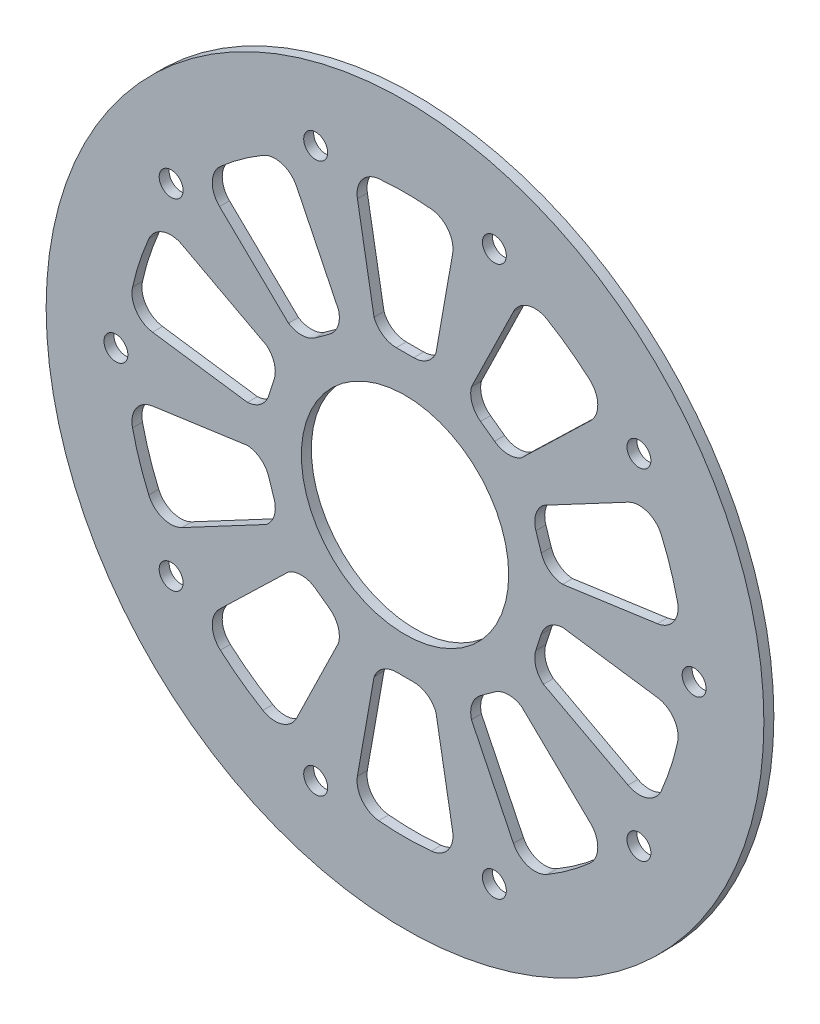
from build123d import *

# Parameters (mm, degrees)
MODEL_R                     = 90
MODEL_R_2                   = 3
MODEL_R_3                   = 26
Y_KSEKLIK_EKSTR_ZYON7_DEPTH = 2.5


with BuildPart() as part:
    # Model → Yükseklik-Ekstrüzyon7 (new body)
    with BuildSketch(Plane.XY):
        Circle(MODEL_R)
        with Locations((-58.653732092, -42.614430791)):
            Circle(MODEL_R_2, mode=Mode.SUBTRACT)
        with Locations((-22.403732092, -68.951597431)):
            Circle(MODEL_R_2, mode=Mode.SUBTRACT)
        with BuildLine():
            ThreePointArc((-18.940576577, -29.779008555), (-16.820231104, -32.605612708), (-16.658403576, -36.135395679))
            Line((-16.658403576, -36.135395679), (-27.194108178, -57.736791298))
            ThreePointArc((-27.194108178, -57.736791298), (-30.862591163, -60.853463931), (-35.640908554, -60.271142184))
            ThreePointArc((-35.640908554, -60.271142184), (-41.157078213, -56.647858351), (-46.307616081, -52.521325533))
            ThreePointArc((-46.307616081, -52.521325533), (-48.338018251, -48.156822957), (-46.50751002, -43.7047835))
            Line((-46.50751002, -43.7047835), (-29.219073725, -27.009534635))
            ThreePointArc((-29.219073725, -27.009534635), (-25.812043174, -26.072678835), (-22.46856009, -27.215778495))
            Line((-22.46856009, -27.215778495), (-18.940576577, -29.779008555))
        make_face(mode=Mode.SUBTRACT)
        with BuildLine():
            ThreePointArc((2.180413722, -35.224715579), (5.55724548, -36.265178576), (7.762921073, -39.025713151))
            Line((7.762921073, -39.025713151), (11.936338777, -62.694341097))
            ThreePointArc((11.936338777, -62.694341097), (10.800407909, -67.37206242), (6.592387799, -69.709578724))
            ThreePointArc((6.592387799, -69.709578724), (0, -70.020603702), (-6.592387799, -69.709578724))
            ThreePointArc((-6.592387799, -69.709578724), (-10.800407909, -67.37206242), (-11.936338777, -62.694341097))
            Line((-11.936338777, -62.694341097), (-7.762921073, -39.025713151))
            ThreePointArc((-7.762921073, -39.025713151), (-5.55724548, -36.265178576), (-2.180413722, -35.224715579))
            Line((-2.180413722, -35.224715579), (2.180413722, -35.224715579))
        make_face(mode=Mode.SUBTRACT)
        with BuildLine():
            ThreePointArc((-32.826910391, -12.958732415), (-32.772951104, -16.49181101), (-34.716784258, -19.442585254))
            Line((-34.716784258, -19.442585254), (-55.937330103, -30.725749625))
            ThreePointArc((-55.937330103, -30.725749625), (-60.737129391, -31.090910554), (-64.26058923, -27.811177871))
            ThreePointArc((-64.26058923, -27.811177871), (-66.593551426, -21.6375565), (-68.334908957, -15.271711122))
            ThreePointArc((-68.334908957, -15.271711122), (-67.412148571, -10.547313914), (-63.314393168, -8.021484076))
            Line((-63.314393168, -8.021484076), (-39.514533333, -4.676631909))
            ThreePointArc((-39.514533333, -4.676631909), (-36.207517694, -5.921301958), (-34.174480181, -8.811339057))
            Line((-34.174480181, -8.811339057), (-32.826910391, -12.958732415))
        make_face(mode=Mode.SUBTRACT)
        with Locations((22.403732092, -68.951597431)):
            Circle(MODEL_R_2, mode=Mode.SUBTRACT)
        with BuildLine():
            ThreePointArc((22.46856009, -27.215778495), (25.812043174, -26.072678835), (29.219073725, -27.009534635))
            Line((29.219073725, -27.009534635), (46.50751002, -43.7047835))
            ThreePointArc((46.50751002, -43.7047835), (48.338018251, -48.156822957), (46.307616081, -52.521325533))
            ThreePointArc((46.307616081, -52.521325533), (41.157078213, -56.647858351), (35.640908554, -60.271142184))
            ThreePointArc((35.640908554, -60.271142184), (30.862591163, -60.853463931), (27.194108178, -57.736791298))
            Line((27.194108178, -57.736791298), (16.658403576, -36.135395679))
            ThreePointArc((16.658403576, -36.135395679), (16.820231104, -32.605612708), (18.940576577, -29.779008555))
            Line((18.940576577, -29.779008555), (22.46856009, -27.215778495))
        make_face(mode=Mode.SUBTRACT)
        with Locations((58.653732092, -42.614430791)):
            Circle(MODEL_R_2, mode=Mode.SUBTRACT)
        with BuildLine():
            ThreePointArc((34.174480181, -8.811339057), (36.207517694, -5.921301958), (39.514533333, -4.676631909))
            Line((39.514533333, -4.676631909), (63.314393168, -8.021484076))
            ThreePointArc((63.314393168, -8.021484076), (67.412148571, -10.547313914), (68.334908957, -15.271711122))
            ThreePointArc((68.334908957, -15.271711122), (66.593551426, -21.6375565), (64.26058923, -27.811177871))
            ThreePointArc((64.26058923, -27.811177871), (60.737129391, -31.090910554), (55.937330103, -30.725749625))
            Line((55.937330103, -30.725749625), (34.716784258, -19.442585254))
            ThreePointArc((34.716784258, -19.442585254), (32.772951104, -16.49181101), (32.826910391, -12.958732415))
            Line((32.826910391, -12.958732415), (34.174480181, -8.811339057))
        make_face(mode=Mode.SUBTRACT)
        with Locations((72.5, 0)):
            Circle(MODEL_R_2, mode=Mode.SUBTRACT)
        with Locations((-72.5, 0)):
            Circle(MODEL_R_2, mode=Mode.SUBTRACT)
        with BuildLine():
            ThreePointArc((-34.174480181, 8.811339057), (-36.207517694, 5.921301958), (-39.514533333, 4.676631909))
            Line((-39.514533333, 4.676631909), (-63.314393168, 8.021484076))
            ThreePointArc((-63.314393168, 8.021484076), (-67.412148571, 10.547313914), (-68.334908957, 15.271711122))
            ThreePointArc((-68.334908957, 15.271711122), (-66.593551426, 21.6375565), (-64.26058923, 27.811177871))
            ThreePointArc((-64.26058923, 27.811177871), (-60.737129391, 31.090910554), (-55.937330103, 30.725749625))
            Line((-55.937330103, 30.725749625), (-34.716784258, 19.442585254))
            ThreePointArc((-34.716784258, 19.442585254), (-32.772951104, 16.49181101), (-32.826910391, 12.958732415))
            Line((-32.826910391, 12.958732415), (-34.174480181, 8.811339057))
        make_face(mode=Mode.SUBTRACT)
        Circle(MODEL_R_3, mode=Mode.SUBTRACT)
        with Locations((-58.653732092, 42.614430791)):
            Circle(MODEL_R_2, mode=Mode.SUBTRACT)
        with BuildLine():
            ThreePointArc((-22.46856009, 27.215778495), (-25.812043174, 26.072678835), (-29.219073725, 27.009534635))
            Line((-29.219073725, 27.009534635), (-46.50751002, 43.7047835))
            ThreePointArc((-46.50751002, 43.7047835), (-48.338018251, 48.156822957), (-46.307616081, 52.521325533))
            ThreePointArc((-46.307616081, 52.521325533), (-41.157078213, 56.647858351), (-35.640908554, 60.271142184))
            ThreePointArc((-35.640908554, 60.271142184), (-30.862591163, 60.853463931), (-27.194108178, 57.736791298))
            Line((-27.194108178, 57.736791298), (-16.658403576, 36.135395679))
            ThreePointArc((-16.658403576, 36.135395679), (-16.820231104, 32.605612708), (-18.940576577, 29.779008555))
            Line((-18.940576577, 29.779008555), (-22.46856009, 27.215778495))
        make_face(mode=Mode.SUBTRACT)
        with BuildLine():
            ThreePointArc((-2.180413722, 35.224715579), (-5.55724548, 36.265178576), (-7.762921073, 39.025713151))
            Line((-7.762921073, 39.025713151), (-11.936338777, 62.694341097))
            ThreePointArc((-11.936338777, 62.694341097), (-10.800407909, 67.37206242), (-6.592387799, 69.709578724))
            ThreePointArc((-6.592387799, 69.709578724), (0, 70.020603702), (6.592387799, 69.709578724))
            ThreePointArc((6.592387799, 69.709578724), (10.800407909, 67.37206242), (11.936338777, 62.694341097))
            Line((11.936338777, 62.694341097), (7.762921073, 39.025713151))
            ThreePointArc((7.762921073, 39.025713151), (5.55724548, 36.265178576), (2.180413722, 35.224715579))
            Line((2.180413722, 35.224715579), (-2.180413722, 35.224715579))
        make_face(mode=Mode.SUBTRACT)
        with Locations((-22.403732092, 68.951597431)):
            Circle(MODEL_R_2, mode=Mode.SUBTRACT)
        with BuildLine():
            ThreePointArc((32.826910391, 12.958732415), (32.772951104, 16.49181101), (34.716784258, 19.442585254))
            Line((34.716784258, 19.442585254), (55.937330103, 30.725749625))
            ThreePointArc((55.937330103, 30.725749625), (60.737129391, 31.090910554), (64.26058923, 27.811177871))
            ThreePointArc((64.26058923, 27.811177871), (66.593551426, 21.6375565), (68.334908957, 15.271711122))
            ThreePointArc((68.334908957, 15.271711122), (67.412148571, 10.547313914), (63.314393168, 8.021484076))
            Line((63.314393168, 8.021484076), (39.514533333, 4.676631909))
            ThreePointArc((39.514533333, 4.676631909), (36.207517694, 5.921301958), (34.174480181, 8.811339057))
            Line((34.174480181, 8.811339057), (32.826910391, 12.958732415))
        make_face(mode=Mode.SUBTRACT)
        with BuildLine():
            ThreePointArc((18.940576577, 29.779008555), (16.820231104, 32.605612708), (16.658403576, 36.135395679))
            Line((16.658403576, 36.135395679), (27.194108178, 57.736791298))
            ThreePointArc((27.194108178, 57.736791298), (30.862591163, 60.853463931), (35.640908554, 60.271142184))
            ThreePointArc((35.640908554, 60.271142184), (41.157078213, 56.647858351), (46.307616081, 52.521325533))
            ThreePointArc((46.307616081, 52.521325533), (48.338018251, 48.156822957), (46.50751002, 43.7047835))
            Line((46.50751002, 43.7047835), (29.219073725, 27.009534635))
            ThreePointArc((29.219073725, 27.009534635), (25.812043174, 26.072678835), (22.46856009, 27.215778495))
            Line((22.46856009, 27.215778495), (18.940576577, 29.779008555))
        make_face(mode=Mode.SUBTRACT)
        with Locations((22.403732092, 68.951597431)):
            Circle(MODEL_R_2, mode=Mode.SUBTRACT)
        with Locations((58.653732092, 42.614430791)):
            Circle(MODEL_R_2, mode=Mode.SUBTRACT)
    extrude(amount=Y_KSEKLIK_EKSTR_ZYON7_DEPTH)


solid = part.part
